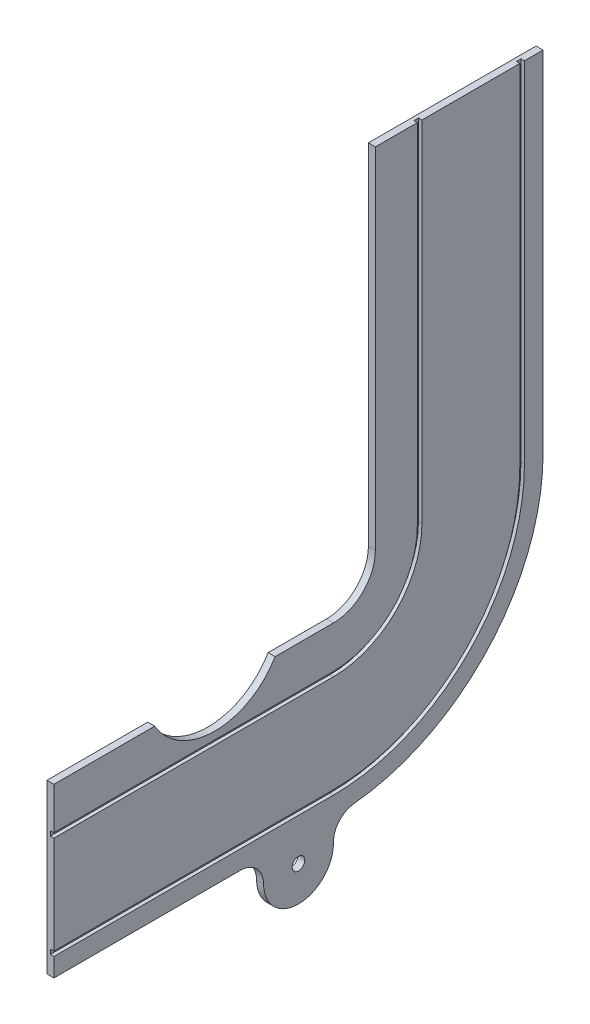
from build123d import *

# Parameters (mm, degrees)
BOSS_EXTRUDE1_DEPTH = 3
CUT_EXTRUDE1_DEPTH  = 1.5
BOSS_EXTRUDE2_DEPTH = 3
FILLET1_R           = 10
SKETCH4_R           = 2.7
CUT_EXTRUDE2_DEPTH  = 193.117151759
SKETCH5_R           = 30
CUT_EXTRUDE3_DEPTH  = 193.117151759


with BuildPart() as part:
    # Sketch1 → Boss-Extrude1 (new body)
    with BuildSketch(Plane(origin=(0, 0, 0), x_dir=(0, 0, -1), z_dir=(1, 0, 0))):
        with BuildLine():
            Line((0, -18), (-120, -18))
            Line((-120, -18), (-120, -90))
            Line((-120, -90), (0, -90))
            ThreePointArc((0, -90), (63.639610307, -63.639610307), (90, 0))
            Line((90, 0), (90, 150))
            Line((90, 150), (18, 150))
            Line((18, 150), (18, 0))
            ThreePointArc((18, 0), (12.727922061, -12.727922061), (0, -18))
        make_face()
    extrude(amount=BOSS_EXTRUDE1_DEPTH)

    # Sketch2 → Cut-Extrude1 (cut)
    with BuildSketch(Plane(origin=(3, 0, 0), x_dir=(0, 0, -1), z_dir=(1, 0, 0))):
        with BuildLine():
            Line((0, -38), (-120, -38))
            Line((-120, -38), (-120, -36))
            Line((-120, -36), (0, -36))
            ThreePointArc((0, -36), (25.455844123, -25.455844123), (36, 0))
            Line((36, 0), (36, 150))
            Line((36, 150), (38, 150))
            Line((38, 150), (38, 0))
            ThreePointArc((38, 0), (26.870057685, -26.870057685), (0, -38))
        make_face()
        with BuildLine():
            Line((0, -80), (-120, -80))
            Line((-120, -80), (-120, -82))
            Line((-120, -82), (0, -82))
            ThreePointArc((0, -82), (57.982756057, -57.982756057), (82, 0))
            Line((82, 0), (82, 150))
            Line((82, 150), (80, 150))
            Line((80, 150), (80, 0))
            ThreePointArc((80, 0), (56.568542495, -56.568542495), (0, -80))
        make_face()
    extrude(amount=-CUT_EXTRUDE1_DEPTH, mode=Mode.SUBTRACT)

    # Sketch3 → Boss-Extrude2 (add)
    with BuildSketch(Plane(origin=(3, 0, 0), x_dir=(0, 0, -1), z_dir=(1, 0, 0))):
        with BuildLine():
            Line((-30, -90), (-30, -100))
            ThreePointArc((-30, -100), (-29.012585384, -94.647668653), (-26.180339887, -90))
            Line((-26.180339887, -90), (-30, -90))
        make_face()
        with BuildLine():
            ThreePointArc((-26.180339887, -90), (-29.012585384, -94.647668653), (-30, -100))
            Line((-30, -100), (0, -100))
            ThreePointArc((0, -100), (-0.987414616, -94.647668653), (-3.819660113, -90))
            Line((-3.819660113, -90), (-26.180339887, -90))
        make_face()
        with BuildLine():
            ThreePointArc((-3.819660113, -90), (-0.987414616, -94.647668653), (0, -100))
            Line((0, -100), (0, -90))
            Line((0, -90), (-3.819660113, -90))
        make_face()
        with BuildLine():
            Line((0, -100), (-30, -100))
            ThreePointArc((-30, -100), (-15, -115), (0, -100))
        make_face()
    extrude(amount=-BOSS_EXTRUDE2_DEPTH)

    # Fillet1
    fillet1_edges = [part.edges().sort_by_distance(p)[0] for p in [
        (1.5, -90, 0),
        (1.5, -90, 30),
    ]]
    fillet(fillet1_edges, radius=FILLET1_R - 0.0001)  # a hair under: the kernel refuses the full size

    # Sketch4 → Cut-Extrude2 (cut, through all)
    with BuildSketch(Plane(origin=(3, 0, 0), x_dir=(0, 0, -1), z_dir=(1, 0, 0))):
        with Locations((-15, -100)):
            Circle(SKETCH4_R)
    extrude(amount=-CUT_EXTRUDE2_DEPTH, mode=Mode.SUBTRACT)

    # Sketch5 → Cut-Extrude3 (cut, through all)
    with BuildSketch(Plane(origin=(3, 0, 0), x_dir=(0, 0, -1), z_dir=(1, 0, 0))):
        with Locations((-50.880906171, -2.772036536)):
            Circle(SKETCH5_R)
    extrude(amount=-CUT_EXTRUDE3_DEPTH, mode=Mode.SUBTRACT)


solid = part.part
